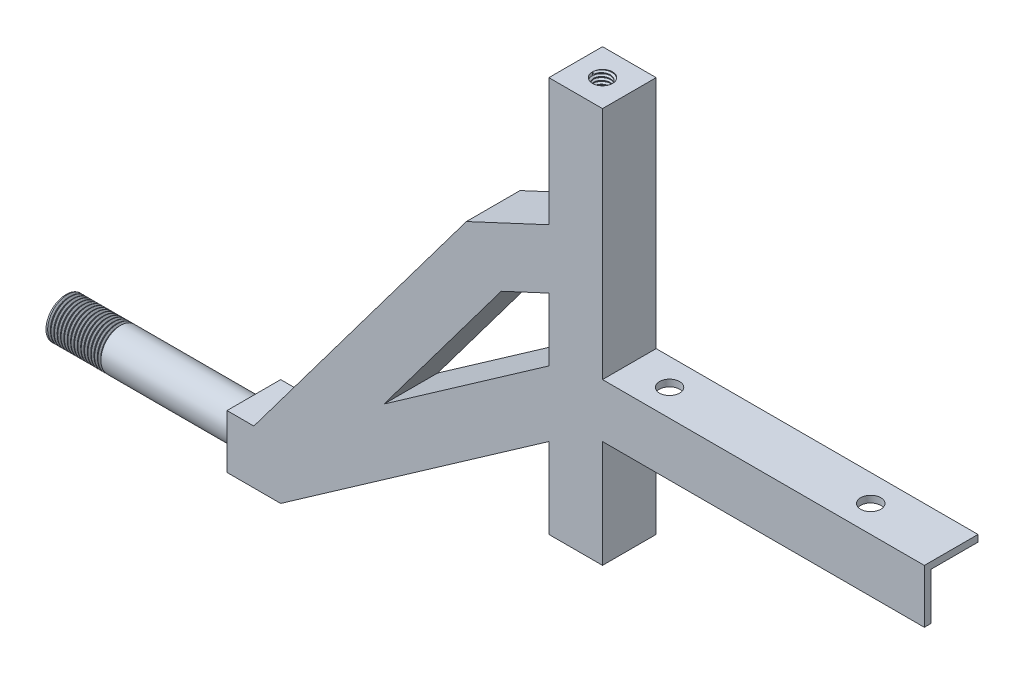
from build123d import *
from build123d.topology import SkipClean

# Parameters (mm, degrees)
SKETCH1_W               = 25.4
SKETCH1_H               = 25.4
SKETCH1_W_2             = 20.32
SKETCH1_H_2             = 20.32
SQ_TB_EXTRUDE_DEPTH     = 187.325
SKETCH3_W               = 20.32
SKETCH3_H               = 20.32
SKETCH3_R               = 4.7625
END_CAPS_DEPTH          = 6.35
TOP_THREAD_PITCH        = 1.5875
BOTTOM_THREAD_PITCH     = 1.5875
SQ_TB_ANGLES_DEPTH      = 12.7
SQ_TB_ANGLES_DEPTH_BACK = 12.7
SKETCH11_W              = 88.9
SKETCH11_H              = 9.525
WHEEL_THREADS_PITCH     = 1.5875
BOSS_EXTRUDE2_DEPTH     = 152.4
SKETCH20_R              = 4.7625
CUT_EXTRUDE2_DEPTH      = 285.264472557


with BuildPart() as part:
    # Sketch1 → Sq_Tb Extrude (new body)
    with BuildSketch(Plane(origin=(0, 0, 0), x_dir=(1, 0, 0), z_dir=(0, 1, 0))):
        Rectangle(SKETCH1_W, SKETCH1_H)
        Rectangle(SKETCH1_W_2, SKETCH1_H_2, mode=Mode.SUBTRACT)
    extrude(amount=SQ_TB_EXTRUDE_DEPTH)

    # Sketch3 → End Caps (add)
    with BuildSketch(Plane(origin=(0, 187.325, 0), x_dir=(1, 0, 0), z_dir=(0, 1, 0))):
        Rectangle(SKETCH3_W, SKETCH3_H)
        with Locations(Location((0, 0, 0), (0, 0, 270))):
            Circle(SKETCH3_R, mode=Mode.SUBTRACT)
    end_caps = extrude(amount=-END_CAPS_DEPTH)

    # End Cap Mirror: End Caps across plane
    add(end_caps.mirror(Plane.ZX.offset(93.6625)))

    # Top Thread: the profile of Thread Profile1 profile screwed along a right-hand helix of 4 turns, 8 arcs to a turn; built about Z, then put on its axis
    with SkipClean():  # the faces are left unmerged after this step: merging them gives an invalid solid
        top_thread_z = Axis((0, 0, 0), (0, 0, 1))
        top_thread_corners = [(4.7628, 0, -0.000173205), (4.7628, 0, 1.389235701), (3.903240423, 0, 0.892968748), (3.903240423, 0, 0.496093748)]
        with BuildLine(mode=Mode.PRIVATE) as top_thread_profile:
            Line(top_thread_corners[0], top_thread_corners[1])
            Line(top_thread_corners[1], top_thread_corners[2])
            Line(top_thread_corners[2], top_thread_corners[3])
            Line(top_thread_corners[3], top_thread_corners[0])
        top_thread_cap = Face(top_thread_profile.wire())
        top_thread_turn_angles = [0, 22.5, 45, 67.5, 90, 112.5, 135, 157.5, 180, 202.5, 225, 247.5, 270, 292.5, 315, 337.5, 360]
        top_thread_turn_weights = [1, 0.9238795325112867, 1, 0.9238795325112867, 1, 0.9238795325112867, 1, 0.9238795325112867, 1, 0.9238795325112867, 1, 0.9238795325112867, 1, 0.9238795325112867, 1, 0.9238795325112867, 1]
        top_thread_turn_rails = [Edge.make_bspline([Vector(p[0], p[1], 0).rotate(top_thread_z, top_thread_turn_angles[k]) / top_thread_turn_weights[k] + Vector(0, 0, p[2] + TOP_THREAD_PITCH * top_thread_turn_angles[k] / 360) for k in range(17)], [0, 0, 0, 1, 1, 2, 2, 3, 3, 4, 4, 5, 5, 6, 6, 7, 7, 8, 8, 8], 2, top_thread_turn_weights) for p in top_thread_corners]
        top_thread_turn_sides = [Face.make_surface_from_curves(top_thread_turn_rails[p[0]], top_thread_turn_rails[p[1]]) for p in [(0, 1), (1, 2), (2, 3), (3, 0)]]
        top_thread = Plane(origin=(0, 187.325, 0), x_dir=(-1, 0, 0), z_dir=(0, -1, 0)) * Solid(Shell([*[p.moved(Location((0, 0, TOP_THREAD_PITCH * i))) for i in range(4) for p in top_thread_turn_sides], top_thread_cap, top_thread_cap.rotate(top_thread_z, 1440).moved(Location((0, 0, TOP_THREAD_PITCH * 1440 / 360)))]))
        add(top_thread)

    # Bottom Thread: the profile of Thread Profile2 profile screwed along a right-hand helix of 4 turns, 8 arcs to a turn; built about Z, then put on its axis
    with SkipClean():  # the faces are left unmerged after this step: merging them gives an invalid solid
        bottom_thread_z = Axis((0, 0, 0), (0, 0, 1))
        bottom_thread_corners = [(4.7628, 0, -0.000173205), (4.7628, 0, 1.389235701), (3.903240423, 0, 0.892968748), (3.903240423, 0, 0.496093748)]
        with BuildLine(mode=Mode.PRIVATE) as bottom_thread_profile:
            Line(bottom_thread_corners[0], bottom_thread_corners[1])
            Line(bottom_thread_corners[1], bottom_thread_corners[2])
            Line(bottom_thread_corners[2], bottom_thread_corners[3])
            Line(bottom_thread_corners[3], bottom_thread_corners[0])
        bottom_thread_cap = Face(bottom_thread_profile.wire())
        bottom_thread_turn_angles = [0, 22.5, 45, 67.5, 90, 112.5, 135, 157.5, 180, 202.5, 225, 247.5, 270, 292.5, 315, 337.5, 360]
        bottom_thread_turn_weights = [1, 0.9238795325112867, 1, 0.9238795325112867, 1, 0.9238795325112867, 1, 0.9238795325112867, 1, 0.9238795325112867, 1, 0.9238795325112867, 1, 0.9238795325112867, 1, 0.9238795325112867, 1]
        bottom_thread_turn_rails = [Edge.make_bspline([Vector(p[0], p[1], 0).rotate(bottom_thread_z, bottom_thread_turn_angles[k]) / bottom_thread_turn_weights[k] + Vector(0, 0, p[2] + BOTTOM_THREAD_PITCH * bottom_thread_turn_angles[k] / 360) for k in range(17)], [0, 0, 0, 1, 1, 2, 2, 3, 3, 4, 4, 5, 5, 6, 6, 7, 7, 8, 8, 8], 2, bottom_thread_turn_weights) for p in bottom_thread_corners]
        bottom_thread_turn_sides = [Face.make_surface_from_curves(bottom_thread_turn_rails[p[0]], bottom_thread_turn_rails[p[1]]) for p in [(0, 1), (1, 2), (2, 3), (3, 0)]]
        bottom_thread = Plane(origin=(0, 0, 0), x_dir=(1, 0, 0), z_dir=(0, 1, 0)) * Solid(Shell([*[p.moved(Location((0, 0, BOTTOM_THREAD_PITCH * i))) for i in range(4) for p in bottom_thread_turn_sides], bottom_thread_cap, bottom_thread_cap.rotate(bottom_thread_z, 1440).moved(Location((0, 0, BOTTOM_THREAD_PITCH * 1440 / 360)))]))
        add(bottom_thread)

    # Sketch9 → Sq_Tb Angles (add, two sides: drawn at the far end of the back side and taken through both)
    with SkipClean():  # the faces are left unmerged after this step: merging them gives an invalid solid
        with BuildSketch(Plane.XY.offset(-SQ_TB_ANGLES_DEPTH_BACK)):
            Polygon((-165.1, -25.4), (-152.4, -25.4), (-51.765309591, 108.779587212), (-12.7, 126.996040243), (-12.7, 98.970241101), (-35.263452032, 88.448730624), (-139.7, -50.8), (-165.1, -50.8), align=None)
            Polygon((-12.7, 69.094481668), (-90.752491523, 14.463344637), (-139.7, -50.8), (-12.7, 38.090876738), align=None)
        extrude(amount=SQ_TB_ANGLES_DEPTH + SQ_TB_ANGLES_DEPTH_BACK)

    # Sketch11 → Wheel Rod (revolve)
    with SkipClean():  # the faces are left unmerged after this step: merging them gives an invalid solid
        with BuildSketch(Plane.XY):
            with Locations((-209.55, -33.3375)):
                Rectangle(SKETCH11_W, SKETCH11_H)
        revolve(axis=Axis((-165.1, -38.1, 0), (-1, 0, 0)))

    # Wheel Threads: the profile of Thread Profile3 profile screwed along a right-hand helix of 16 turns, 8 arcs to a turn; built about Z, then put on its axis
    with SkipClean():  # the faces are left unmerged after this step: merging them gives an invalid solid
        wheel_threads_z = Axis((0, 0, 0), (0, 0, 1))
        wheel_threads_corners = [(9.5253, 0, -0.000173205), (9.5253, 0, 1.389235701), (8.665740423, 0, 0.892968748), (8.665740423, 0, 0.496093748)]
        with BuildLine(mode=Mode.PRIVATE) as wheel_threads_profile:
            Line(wheel_threads_corners[0], wheel_threads_corners[1])
            Line(wheel_threads_corners[1], wheel_threads_corners[2])
            Line(wheel_threads_corners[2], wheel_threads_corners[3])
            Line(wheel_threads_corners[3], wheel_threads_corners[0])
        wheel_threads_cap = Face(wheel_threads_profile.wire())
        wheel_threads_turn_angles = [0, 22.5, 45, 67.5, 90, 112.5, 135, 157.5, 180, 202.5, 225, 247.5, 270, 292.5, 315, 337.5, 360]
        wheel_threads_turn_weights = [1, 0.9238795325112867, 1, 0.9238795325112867, 1, 0.9238795325112867, 1, 0.9238795325112867, 1, 0.9238795325112867, 1, 0.9238795325112867, 1, 0.9238795325112867, 1, 0.9238795325112867, 1]
        wheel_threads_turn_rails = [Edge.make_bspline([Vector(p[0], p[1], 0).rotate(wheel_threads_z, wheel_threads_turn_angles[k]) / wheel_threads_turn_weights[k] + Vector(0, 0, p[2] + WHEEL_THREADS_PITCH * wheel_threads_turn_angles[k] / 360) for k in range(17)], [0, 0, 0, 1, 1, 2, 2, 3, 3, 4, 4, 5, 5, 6, 6, 7, 7, 8, 8, 8], 2, wheel_threads_turn_weights) for p in wheel_threads_corners]
        wheel_threads_turn_sides = [Face.make_surface_from_curves(wheel_threads_turn_rails[p[0]], wheel_threads_turn_rails[p[1]]) for p in [(0, 1), (1, 2), (2, 3), (3, 0)]]
        wheel_threads = Plane(origin=(-254, -38.1, 0), x_dir=(0, 0, -1), z_dir=(1, 0, 0)) * Solid(Shell([*[p.moved(Location((0, 0, WHEEL_THREADS_PITCH * i))) for i in range(16) for p in wheel_threads_turn_sides], wheel_threads_cap, wheel_threads_cap.rotate(wheel_threads_z, 5760).moved(Location((0, 0, WHEEL_THREADS_PITCH * 5760 / 360)))]))
        add(wheel_threads, mode=Mode.SUBTRACT)

    # Sketch19 → Boss-Extrude2 (add)
    with SkipClean():  # the faces are left unmerged after this step: merging them gives an invalid solid
        with BuildSketch(Plane(origin=(12.7, 0, 0), x_dir=(0, 0, -1), z_dir=(1, 0, 0))):
            Polygon((12.7, 76.2), (-12.7, 76.2), (-12.7, 50.8), (-9.525, 50.8), (-9.525, 73.025), (12.7, 73.025), align=None)
        extrude(amount=BOSS_EXTRUDE2_DEPTH)

    # Sketch20 → Cut-Extrude2 (cut, through all)
    with SkipClean():  # the faces are left unmerged after this step: merging them gives an invalid solid
        with BuildSketch(Plane(origin=(0, 76.2, 0), x_dir=(1, 0, 0), z_dir=(0, 1, 0))):
            with Locations(Location((127, 0, 0), (0, 0, 270))):
                Circle(SKETCH20_R)
            with Locations(Location((31.75, 0, 0), (0, 0, 270))):
                Circle(SKETCH20_R)
        extrude(amount=-CUT_EXTRUDE2_DEPTH, mode=Mode.SUBTRACT)


solid = part.part
